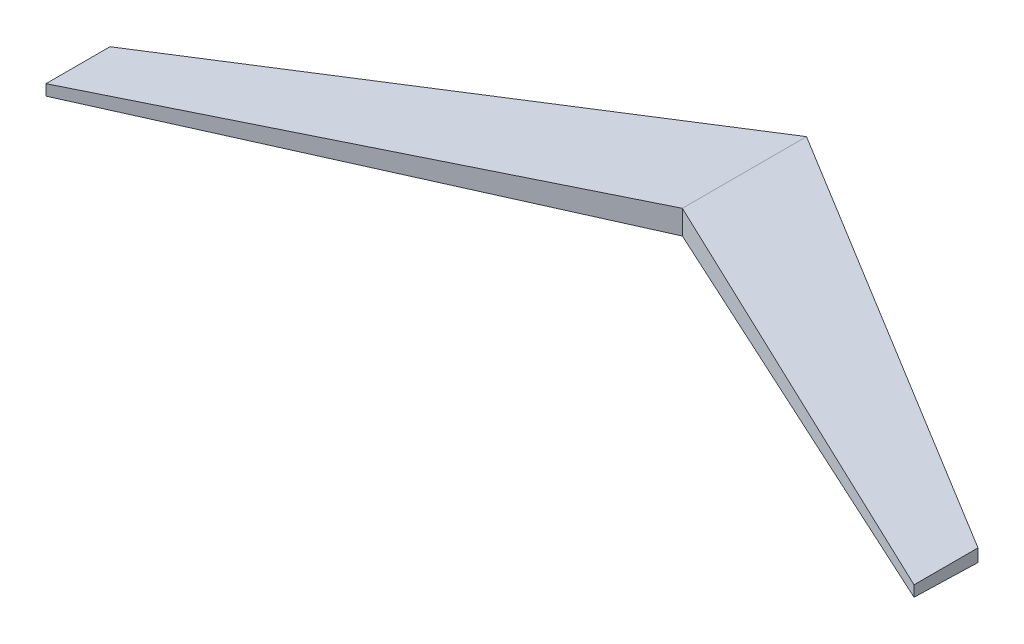
from build123d import *

# Parameters (mm, degrees)
SKETCH4_W          = 14986.678438392
SKETCH4_H          = 7706.357590778
CUT_EXTRUDE1_DEPTH = 5181.6


with BuildPart() as part:
    # Surface-Knit3: read off the stored shape, not the designer's step
    # Surface-Knit3: loft between two sections, ruled curve by curve
    surface_knit3_from = [
        Edge.make_bspline([(-17711.940475464, -80.385008706, 13165.151542886), (-17711.940475464, -85.182687055, 12943.938602187), (-17711.940475464, -89.980365404, 12722.725661487), (-17711.940475464, -99.575722103, 12280.299780089), (-17711.940475464, -104.373400452, 12059.086839389), (-17711.940475464, -109.171078801, 11837.87389869)], [0, 0, 0, 0, 0.5, 0.5, 1, 1, 1, 1], 3),
        Edge.make_line((-17711.940475464, -80.385008706, 13165.151542886), (-17711.940475464, 112.448931944, 13165.151542886)),
        Edge.make_line((-17711.940475464, 112.448931944, 11837.87389869), (-17711.940475464, -109.171078801, 11837.87389869)),
        Edge.make_line((-17711.940475464, 112.448931944, 13165.151542886), (-17711.940475464, 112.448931944, 11837.87389869)),
    ]
    surface_knit3_to = [
        Edge.make_bspline([(0, -298.277774529, 4907.09615841), (0, -321.894328297, 4276.674740223), (0, -345.510882066, 3646.253322036), (0, -392.743989603, 2385.410485661), (0, -416.360543372, 1754.989067474), (0, -439.977097141, 1124.567649286)], [0, 0, 0, 0, 0.5, 0.5, 1, 1, 1, 1], 3),
        Edge.make_line((0, -298.277774529, 4907.09615841), (0, 434.262669848, 4907.09615841)),
        Edge.make_line((0, 434.262669848, 1124.567649286), (0, -439.977097141, 1124.567649286)),
        Edge.make_line((0, 434.262669848, 4907.09615841), (0, 434.262669848, 1124.567649286)),
    ]
    surface_knit3 = Solid(Shell([*[Face.make_surface_from_curves(surface_knit3_from[k], surface_knit3_to[k]) for k in range(4)], Face(Wire(surface_knit3_from)), Face(Wire(surface_knit3_to))]))
    add(surface_knit3)

    # Sketch4 → Cut-Extrude1 (cut, along a direction that is not the sketch's normal)
    with BuildSketch(Plane.ZY.offset(17711.940475464)):
        with Locations((12517.353947819, -161.456903525)):
            Rectangle(SKETCH4_W, SKETCH4_H)
    extrude(amount=-CUT_EXTRUDE1_DEPTH, dir=(-0.8660254037844378, 0, 0.5000000000000014), mode=Mode.SUBTRACT)

    # Mirror1: part across plane


with BuildPart() as part_1:
    add(part.part)
    add(part.part.mirror(Plane(origin=(0, 0, 0), x_dir=(0, 0, 1), z_dir=(1, 0, 0))))


solid = part_1.part
